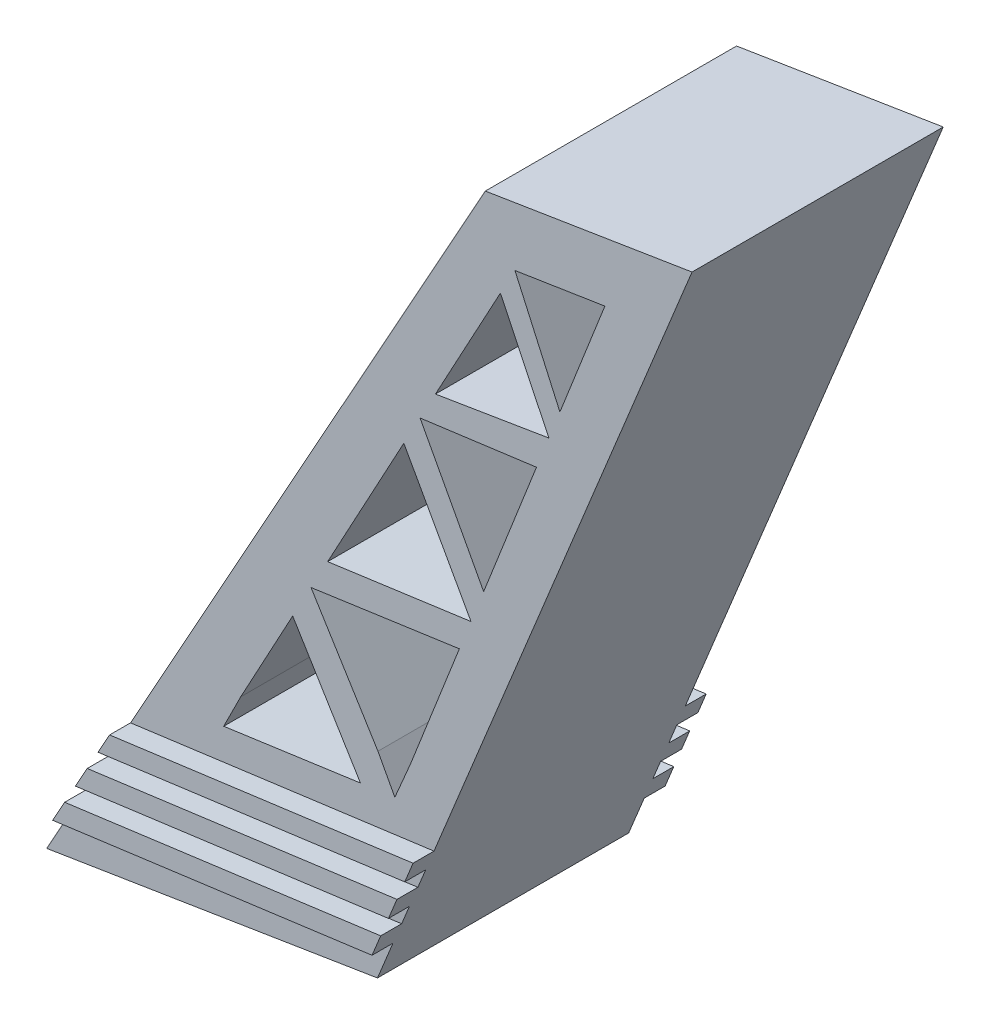
from build123d import *

# Parameters (mm, degrees)
BOSS_EXTRUDE1_DEPTH = 152.4
CUT_EXTRUDE1_DEPTH  = 152.4
BOSS_EXTRUDE2_DEPTH = 12.7
BOSS_EXTRUDE4_DEPTH = 12.7


with BuildPart() as part:
    # Sketch2 → Boss-Extrude1 (new body)
    with BuildSketch(Plane.XY):
        Polygon((170.816057217, 370.137593521), (45.425100065, 349.985475407), (-220.630755565, -128.397811774), (-20.005224121, -96.154422792), align=None)
    extrude(amount=BOSS_EXTRUDE1_DEPTH)

    # Sketch3 → Cut-Extrude1 (cut)
    with BuildSketch(Plane.XY.offset(152.4)):
        Polygon((117.950744878, 325.800588009), (63.389848256, 317.232652873), (90.670296567, 256.515119842), align=None)
        Polygon((54.553223033, 300.917445057), (15.169383816, 228.202409032), (83.978355228, 239.519274196), align=None)
        Polygon((0, 26.235401751), (29.689441611, 101.639106197), (-60.315365611, 88.833663301), (-19.710749195, 23.140136991), (-9.471946327, 4.045769846), align=None)
        Polygon((5.832332135, 210.963255541), (76.456352096, 220.415280647), (44.405434198, 139.014021166), align=None)
        Polygon((-4.016454892, 192.779276588), (36.719547187, 119.493803837), (-50.216365356, 107.479615091), align=None)
        Polygon((-102.978364208, 10.064260888), (-113.279337838, -10.535324889), (-30.325218441, 1.116657267), (-71.427454284, 68.31722955), align=None)
    extrude(amount=-CUT_EXTRUDE1_DEPTH, mode=Mode.SUBTRACT)

    # Sketch4 → Boss-Extrude2 (add)
    with BuildSketch(Plane.XY.offset(152.4)):
        Polygon((-169.802776266, -37.006266341), (14.292347147, -12.344673958), (9.246199568, -24.67547015), (-176.806469295, -49.599297551), align=None)
        Polygon((-183.373062596, -61.406399039), (4.514981516, -36.236702679), (-0.635132085, -48.821550859), (-190.52105305, -74.258885077), align=None)
        Polygon((-197.052094476, -86.002062309), (-5.340735079, -60.32019028), (-10.595647834, -73.161126295), (-204.345538683, -99.116082319), align=None)
    extrude(amount=BOSS_EXTRUDE2_DEPTH)

    # Sketch6 → Boss-Extrude4 (add)
    with BuildSketch(Plane(origin=(0, 0, 0), x_dir=(-1, 0, 0), z_dir=(0, 0, -1))):
        Polygon((10.595647834, -73.161126295), (204.345538683, -99.116082319), (197.052094476, -86.002062309), (5.340735079, -60.32019028), align=None)
        Polygon((0.635132085, -48.821550859), (190.52105305, -74.258885077), (183.373062596, -61.406399039), (-4.305533741, -36.748510504), align=None)
        Polygon((-9.246199568, -24.67547015), (176.806469295, -49.599297551), (169.802776266, -37.006266341), (-14.295186755, -12.337735075), align=None)
    extrude(amount=BOSS_EXTRUDE4_DEPTH)


solid = part.part
